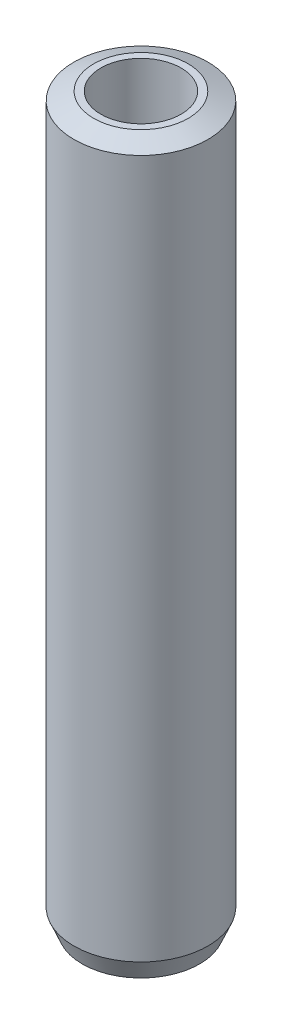
from build123d import *
from OCP.BRepFilletAPI import BRepFilletAPI_MakeChamfer

# Parameters (mm, degrees)
SKETCH1_R           = 17.5
BOSS_EXTRUDE1_DEPTH = 189.616163042
SKETCH2_R           = 10.47173618
CUT_EXTRUDE1_DEPTH  = 192.224447409
CHAMFER1_SIZE       = 2.18248315
CHAMFER1_SIZE2      = 5.161463402


with BuildPart() as part:
    # Sketch1 → Boss-Extrude1 (new body)
    with BuildSketch(Plane(origin=(0, 0, 0), x_dir=(1, 0, 0), z_dir=(0, 1, 0))):
        Circle(SKETCH1_R)
    extrude(amount=BOSS_EXTRUDE1_DEPTH)

    # Sketch2 → Cut-Extrude1 (cut, through all)
    with BuildSketch(Plane(origin=(0, 0, 0), x_dir=(1, 0, 0), z_dir=(0, 1, 0))):
        Circle(SKETCH2_R)
    extrude(amount=CUT_EXTRUDE1_DEPTH, mode=Mode.SUBTRACT)

    # Chamfer1: one chamfer whose edges measure the first distance from different faces: ONE call of the kernel's chamfer builder (chamfer() names one face for all edges)
    chamfer1_edges_1 = [part.edges().sort_by_distance(p)[0] for p in [
        (-17.5, 189.616163042, 0),
    ]]
    chamfer1_side_1 = [part.faces().sort_by_distance(p)[0] for p in [
        (-17.5, 94.808081521, 0),
    ]]
    chamfer1_edges_2 = [part.edges().sort_by_distance(p)[0] for p in [
        (-17.5, 0, 0),
    ]]
    chamfer1_side_2 = [part.faces().sort_by_distance(p)[0] for p in [
        (-17.005025253, 0, 0),
    ]]
    chamfer1 = BRepFilletAPI_MakeChamfer(part.part.solid().wrapped)
    for e in chamfer1_edges_1:
        chamfer1.Add(CHAMFER1_SIZE, CHAMFER1_SIZE2, e.wrapped, chamfer1_side_1[0].wrapped)  # the first distance lies on this face
    for e in chamfer1_edges_2:
        chamfer1.Add(CHAMFER1_SIZE, CHAMFER1_SIZE2, e.wrapped, chamfer1_side_2[0].wrapped)  # the first distance lies on this face
    add(Compound.cast(chamfer1.Shape()), mode=Mode.REPLACE)


solid = part.part
